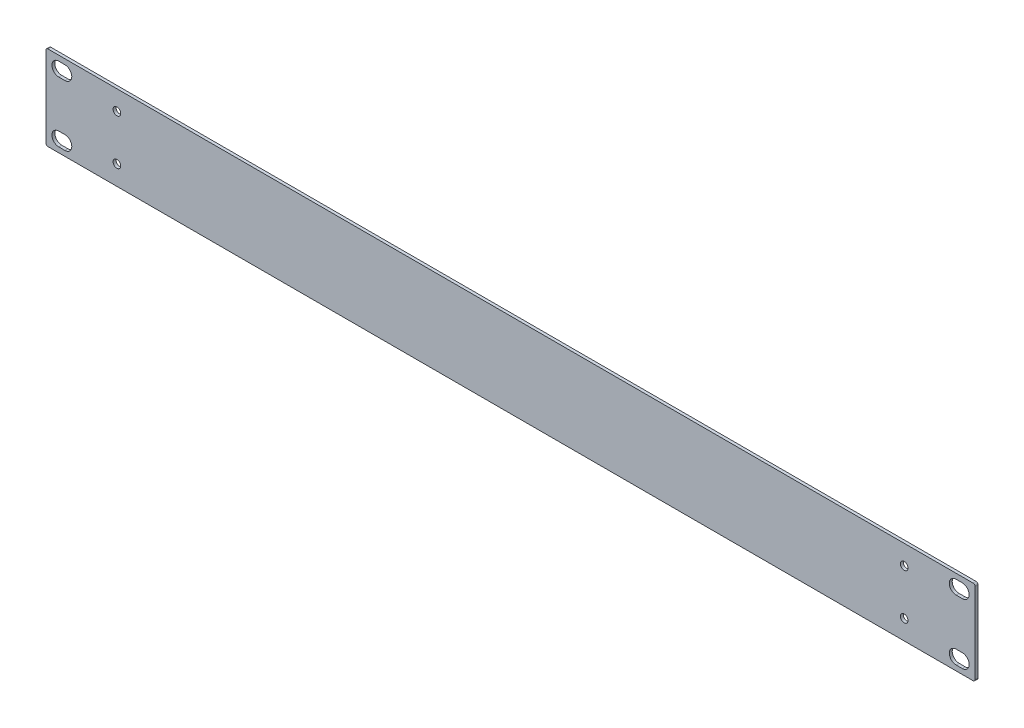
from build123d import *

# Parameters (mm, degrees)
BASE_FLANGE1_DEPTH         = 1.524
CUT_EXTRUDE_MOUNTING_DEPTH = 246.27313742
SKETCH5_R                  = 2
CUT_EXTRUDE_COVER_DEPTH    = 2.54


# Sheet-metal steps are written as plain solids
with BuildPart() as part:
    # Sketch1 → Base-Flange1 (new body)
    with BuildSketch(Plane.XY):
        with BuildLine():
            Line((241.3, 42.926), (241.3, 1.016))
            ThreePointArc((241.3, 1.016), (241.00242049, 0.29757951), (240.284, 0))
            Line((240.284, 0), (-240.284, 0))
            ThreePointArc((-240.284, 0), (-241.00242049, 0.29757951), (-241.3, 1.016))
            Line((-241.3, 1.016), (-241.3, 42.926))
            ThreePointArc((-241.3, 42.926), (-241.00242049, 43.64442049), (-240.284, 43.942))
            Line((-240.284, 43.942), (240.284, 43.942))
            ThreePointArc((240.284, 43.942), (241.00242049, 43.64442049), (241.3, 42.926))
        make_face()
    extrude(amount=-BASE_FLANGE1_DEPTH)

    # Sketch2 → Cut-Extrude-Mounting (cut, through all)
    with BuildSketch(Plane.XY):
        with BuildLine():
            Line((-234.6706, 9.8044), (-231.4702, 9.8044))
            ThreePointArc((-231.4702, 9.8044), (-227.9142, 6.2484), (-231.4702, 2.6924))
            Line((-231.4702, 2.6924), (-234.6706, 2.6924))
            ThreePointArc((-234.6706, 2.6924), (-238.2266, 6.2484), (-234.6706, 9.8044))
        make_face()
        with BuildLine():
            Line((-234.6706, 34.1376), (-231.4702, 34.1376))
            ThreePointArc((-231.4702, 34.1376), (-227.9142, 37.6936), (-231.4702, 41.2496))
            Line((-231.4702, 41.2496), (-234.6706, 41.2496))
            ThreePointArc((-234.6706, 41.2496), (-238.2266, 37.6936), (-234.6706, 34.1376))
        make_face()
        with BuildLine():
            Line((234.6706, 9.8044), (231.4702, 9.8044))
            ThreePointArc((231.4702, 9.8044), (227.9142, 6.2484), (231.4702, 2.6924))
            Line((231.4702, 2.6924), (234.6706, 2.6924))
            ThreePointArc((234.6706, 2.6924), (238.2266, 6.2484), (234.6706, 9.8044))
        make_face()
        with BuildLine():
            Line((234.6706, 34.1376), (231.4702, 34.1376))
            ThreePointArc((231.4702, 34.1376), (227.9142, 37.6936), (231.4702, 41.2496))
            Line((231.4702, 41.2496), (234.6706, 41.2496))
            ThreePointArc((234.6706, 41.2496), (238.2266, 37.6936), (234.6706, 34.1376))
        make_face()
    extrude(amount=-CUT_EXTRUDE_MOUNTING_DEPTH, mode=Mode.SUBTRACT)

    # Sketch5 → Cut-Extrude-Cover (cut)
    with BuildSketch(Plane.XY):
        with Locations((-204.47, 33.782)):
            Circle(SKETCH5_R)
        with Locations((-204.47, 10.16)):
            Circle(SKETCH5_R)
        with Locations((204.47, 10.16)):
            Circle(SKETCH5_R)
        with Locations((204.47, 33.782)):
            Circle(SKETCH5_R)
    extrude(amount=-CUT_EXTRUDE_COVER_DEPTH, mode=Mode.SUBTRACT)


solid = part.part
